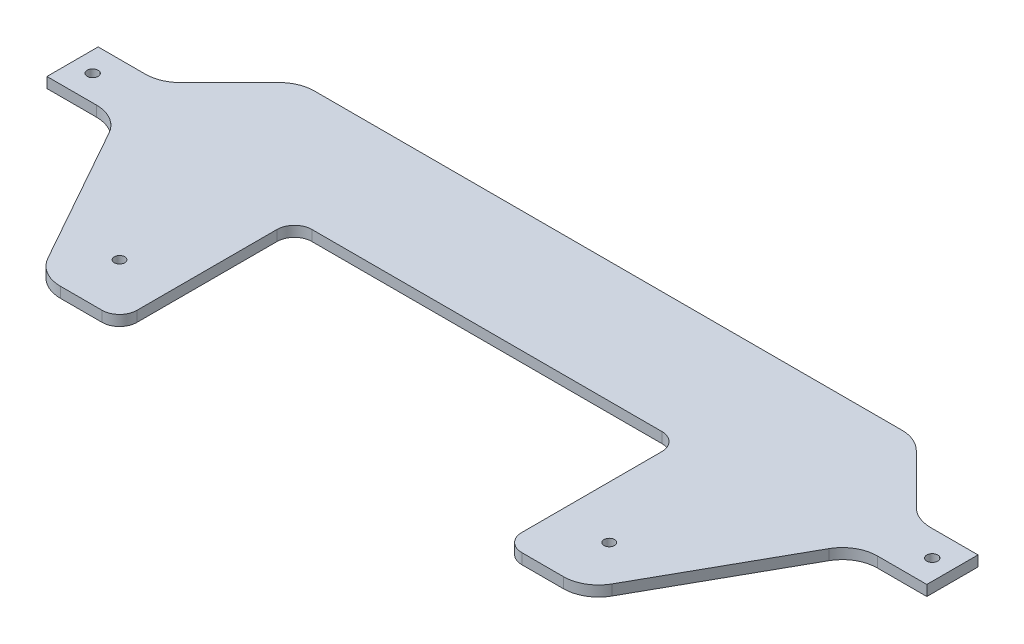
from build123d import *

# Parameters (mm, degrees)
SALIENTE_EXTRUIR1_DEPTH = 3
REDONDEO1_R             = 10
CROQUIS2_R              = 1.5
CROQUIS2_R_2            = 1.55
CORTAR_EXTRUIR1_DEPTH   = 135.610141171
CROQUIS4_W              = 110
CROQUIS4_H              = 50
CORTAR_EXTRUIR2_DEPTH   = 135.610141171
REDONDEO2_R             = 5
CROQUIS5_W              = 4
CROQUIS5_H              = 14.636342218
CORTAR_EXTRUIR3_DEPTH   = 135.610141171
CROQUIS6_W              = 14.636342218
CROQUIS6_H              = 3
SALIENTE_EXTRUIR2_DEPTH = 2
CROQUIS8_W              = 14.636342218
CROQUIS8_H              = 3
SALIENTE_EXTRUIR3_DEPTH = 2


with BuildPart() as part:
    # Croquis1 → Saliente-Extruir1 (new body)
    with BuildSketch(Plane(origin=(0, 0, 0), x_dir=(1, 0, 0), z_dir=(0, 1, 0))):
        Polygon((-88.1, 42.318171109), (88.1, 42.318171109), (108.1, 22.318171109), (127.75, 22.318171109), (127.75, 7.681828891), (105.75, 7.681828891), (77.75, -42.318171109), (-77.75, -42.318171109), (-105.75, 7.681828891), (-127.75, 7.681828891), (-127.75, 22.318171109), (-108.1, 22.318171109), align=None)
    extrude(amount=SALIENTE_EXTRUIR1_DEPTH)

    # Redondeo1
    redondeo1_edges = [part.edges().sort_by_distance(p)[0] for p in [
        (88.1, 1.5, -42.318171109),
        (-88.1, 1.5, -42.318171109),
        (-77.75, 1.5, 42.318171109),
        (77.75, 1.5, 42.318171109),
        (108.1, 1.5, -22.318171109),
        (105.75, 1.5, -7.681828891),
        (-105.75, 1.5, -7.681828891),
        (-108.1, 1.5, -22.318171109),
    ]]
    fillet(redondeo1_edges, radius=REDONDEO1_R)

    # Croquis2 → Cortar-Extruir1 (cut, through all)
    with BuildSketch(Plane(origin=(0, 3, 0), x_dir=(1, 0, 0), z_dir=(0, 1, 0))):
        with Locations((70, -27.318171109)):
            Circle(CROQUIS2_R)
        with Locations((-70, -27.318171109)):
            Circle(CROQUIS2_R)
        with Locations((-119.996067812, 15)):
            Circle(CROQUIS2_R_2)
        with Locations((119.996067812, 15)):
            Circle(CROQUIS2_R_2)
        with Locations((-17.5, -17.318171109)):
            Circle(CROQUIS2_R)
        with Locations((17.5, -17.318171109)):
            Circle(CROQUIS2_R)
        with Locations((-17.5, -37.318171109)):
            Circle(CROQUIS2_R)
        with Locations((17.5, -37.318171109)):
            Circle(CROQUIS2_R)
    extrude(amount=-CORTAR_EXTRUIR1_DEPTH, mode=Mode.SUBTRACT)

    # Croquis4 → Cortar-Extruir2 (cut, through all)
    with BuildSketch(Plane(origin=(0, 3, 0), x_dir=(1, 0, 0), z_dir=(0, 1, 0))):
        with Locations((0, -17.318171109)):
            Rectangle(CROQUIS4_W, CROQUIS4_H)
    extrude(amount=-CORTAR_EXTRUIR2_DEPTH, mode=Mode.SUBTRACT)

    # Redondeo2
    redondeo2_edges = [part.edges().sort_by_distance(p)[0] for p in [
        (-55, 1.5, 42.318171109),
        (55, 1.5, 42.318171109),
        (55, 1.5, -7.681828891),
        (-55, 1.5, -7.681828891),
    ]]
    fillet(redondeo2_edges, radius=REDONDEO2_R)

    # Croquis5 → Cortar-Extruir3 (cut, through all)
    with BuildSketch(Plane(origin=(0, 3, 0), x_dir=(1, 0, 0), z_dir=(0, 1, 0))):
        with Locations((-125.75, 15)):
            Rectangle(CROQUIS5_W, CROQUIS5_H)
        with Locations((125.75, 15)):
            Rectangle(CROQUIS5_W, CROQUIS5_H)
    extrude(amount=-CORTAR_EXTRUIR3_DEPTH, mode=Mode.SUBTRACT)

    # Croquis6 → Saliente-Extruir2 (add)
    with BuildSketch(Plane(origin=(123.75, 0, 0), x_dir=(0, 0, -1), z_dir=(1, 0, 0))):
        with Locations((15, 1.5)):
            Rectangle(CROQUIS6_W, CROQUIS6_H)
    extrude(amount=SALIENTE_EXTRUIR2_DEPTH)

    # Croquis8 → Saliente-Extruir3 (add)
    with BuildSketch(Plane.ZY.offset(123.75)):
        with Locations((-15, 1.5)):
            Rectangle(CROQUIS8_W, CROQUIS8_H)
    extrude(amount=SALIENTE_EXTRUIR3_DEPTH)


solid = part.part
